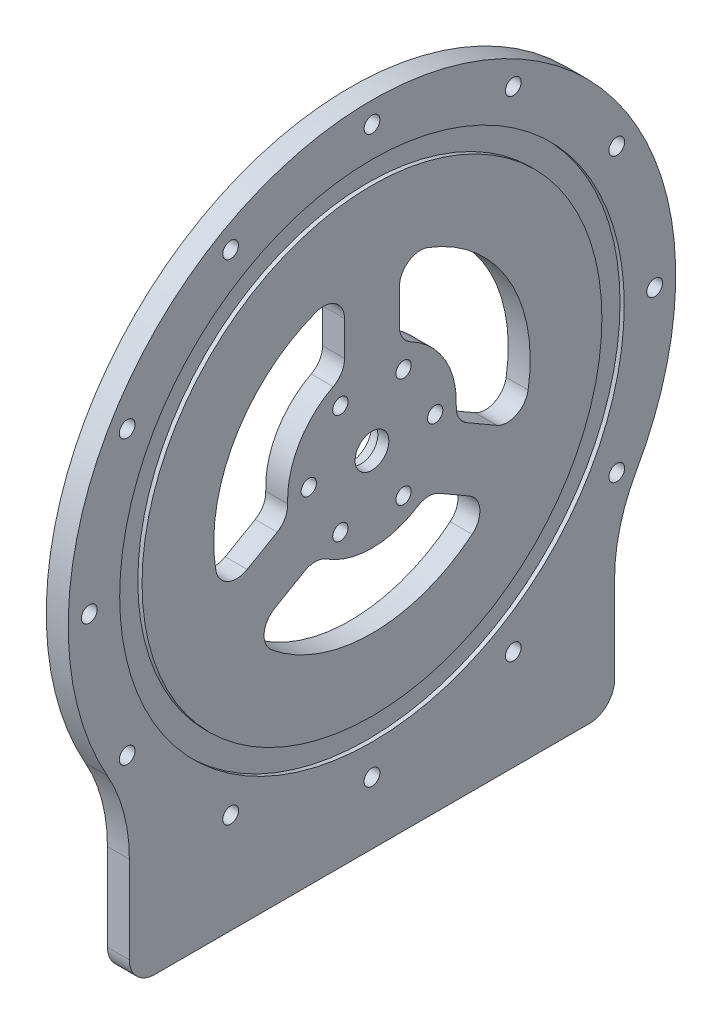
from build123d import *

# Parameters (mm, degrees)
SKETCH1_R              = 5.08
BOSS_EXTRUDE1_DEPTH    = 6.604
SKETCH2_R              = 6.477
CUT_EXTRUDE1_DEPTH     = 3.302
SKETCH3_R              = 75.946
SKETCH3_R_2            = 69.215
CUT_EXTRUDE2_DEPTH     = 1.27
SKETCH4_R              = 2.38125
CUT_EXTRUDE3_DEPTH     = 139.530727768
SKETCH5_R              = 3.77825
CUT_EXTRUDE4_DEPTH     = 1.27
F_12_28_TAPPED_HOLE1_D = 4.6228
CUT_EXTRUDE5_DEPTH     = 139.530727768


with BuildPart() as part:
    # Sketch1 → Boss-Extrude1 (new body)
    with BuildSketch(Plane(origin=(0, 0, 0), x_dir=(0, 0, -1), z_dir=(1, 0, 0))):
        with BuildLine():
            Line((-65.405, -103.855072673), (65.405, -103.855072673))
            ThreePointArc((65.405, -103.855072673), (70.793153673, -101.623226346), (73.025, -96.235072673))
            Line((73.025, -96.235072673), (73.025, -69.997049759))
            ThreePointArc((73.025, -69.997049759), (74.696702219, -57.072253546), (79.601785714, -44.998103417))
            ThreePointArc((79.601785714, -44.998103417), (0, 91.44), (-79.601785714, -44.998103417))
            ThreePointArc((-79.601785714, -44.998103417), (-74.696702219, -57.072253546), (-73.025, -69.997049759))
            Line((-73.025, -69.997049759), (-73.025, -96.235072673))
            ThreePointArc((-73.025, -96.235072673), (-70.793153673, -101.623226346), (-65.405, -103.855072673))
        make_face()
        Circle(SKETCH1_R, mode=Mode.SUBTRACT)
    extrude(amount=BOSS_EXTRUDE1_DEPTH)

    # Sketch2 → Cut-Extrude1 (cut)
    with BuildSketch(Plane(origin=(0, 0, 0), x_dir=(0, 0, -1), z_dir=(1, 0, 0))):
        Circle(SKETCH2_R)
    extrude(amount=CUT_EXTRUDE1_DEPTH, mode=Mode.SUBTRACT)

    # Sketch3 → Cut-Extrude2 (cut)
    with BuildSketch(Plane(origin=(6.604, 0, 0), x_dir=(0, 0, -1), z_dir=(1, 0, 0))):
        Circle(SKETCH3_R)
        Circle(SKETCH3_R_2, mode=Mode.SUBTRACT)
    extrude(amount=-CUT_EXTRUDE2_DEPTH, mode=Mode.SUBTRACT)

    # Sketch4 → Cut-Extrude3 (cut, through all)
    with BuildSketch(Plane.ZY):
        with Locations((0, 85.09)):
            Circle(SKETCH4_R)
        with Locations((42.545, 73.690101608)):
            Circle(SKETCH4_R)
        with Locations((73.690101608, 42.545)):
            Circle(SKETCH4_R)
        with Locations((85.09, 0)):
            Circle(SKETCH4_R)
        with Locations((73.690101608, -42.545)):
            Circle(SKETCH4_R)
        with Locations((42.545, -73.690101608)):
            Circle(SKETCH4_R)
        with Locations((0, -85.09)):
            Circle(SKETCH4_R)
        with Locations((-42.545, -73.690101608)):
            Circle(SKETCH4_R)
        with Locations((-73.690101608, -42.545)):
            Circle(SKETCH4_R)
        with Locations((-85.09, 0)):
            Circle(SKETCH4_R)
        with Locations((-73.690101608, 42.545)):
            Circle(SKETCH4_R)
        with Locations((-42.545, 73.690101608)):
            Circle(SKETCH4_R)
    extrude(amount=-CUT_EXTRUDE3_DEPTH, mode=Mode.SUBTRACT)

    # Sketch5 → Cut-Extrude4 (cut)
    with BuildSketch(Plane.ZY):
        with Locations((0, 85.09)):
            Circle(SKETCH5_R)
        with Locations((42.545, 73.690101608)):
            Circle(SKETCH5_R)
        with Locations((-42.545, 73.690101608)):
            Circle(SKETCH5_R)
        with Locations((73.690101608, 42.545)):
            Circle(SKETCH5_R)
        with Locations((85.09, 0)):
            Circle(SKETCH5_R)
        with Locations((73.690101608, -42.545)):
            Circle(SKETCH5_R)
        with Locations((42.545, -73.690101608)):
            Circle(SKETCH5_R)
        with Locations((0, -85.09)):
            Circle(SKETCH5_R)
        with Locations((-42.545, -73.690101608)):
            Circle(SKETCH5_R)
        with Locations((-73.690101608, -42.545)):
            Circle(SKETCH5_R)
        with Locations((-85.09, 0)):
            Circle(SKETCH5_R)
        with Locations((-73.690101608, 42.545)):
            Circle(SKETCH5_R)
    extrude(amount=-CUT_EXTRUDE4_DEPTH, mode=Mode.SUBTRACT)

    # #12-28 Tapped Hole1 (through all)
    with Locations(Plane(origin=(0, -19.744236158, 32.427308481), x_dir=(0, 0, 1), z_dir=(-1, 0, 0))):
        with Locations((-41.933180497, 36.208889459), (-22.921436466, 36.208889459), (-13.41556445, 19.744236158), (-22.921436466, 3.279582857), (-41.933180497, 3.279582857), (-51.439052512, 19.744236158)):
            Hole(F_12_28_TAPPED_HOLE1_D / 2)

    # Sketch9 → Cut-Extrude5 (cut, through all)
    with BuildSketch(Plane.ZY):
        with BuildLine():
            Line((-8.255, 38.60465775), (-8.255, 28.191425558))
            ThreePointArc((-8.255, 28.191425558), (-9.179557622, 24.89186877), (-11.684, 22.553140447))
            ThreePointArc((-11.684, 22.553140447), (-21.997045256, 12.7), (-25.373592562, -1.157929405))
            ThreePointArc((-25.373592562, -1.157929405), (-26.146769513, -4.496204289), (-28.541990702, -6.946673071))
            Line((-28.541990702, -6.946673071), (-37.560114316, -12.153289167))
            ThreePointArc((-37.560114316, -12.153289167), (-43.454984563, -12.392041955), (-47.00205498, -7.677724445))
            ThreePointArc((-47.00205498, -7.677724445), (-41.244459855, 23.8125), (-16.851923077, 44.543835865))
            ThreePointArc((-16.851923077, 44.543835865), (-10.995669144, 43.82914153), (-8.255, 38.60465775))
        make_face()
        with BuildLine():
            Line((8.255, 38.60465775), (8.255, 28.191425558))
            ThreePointArc((8.255, 28.191425558), (9.179557622, 24.89186877), (11.684, 22.553140447))
            ThreePointArc((11.684, 22.553140447), (21.997045256, 12.7), (25.373592562, -1.157929405))
            ThreePointArc((25.373592562, -1.157929405), (26.146769513, -4.496204289), (28.541990702, -6.946673071))
            Line((28.541990702, -6.946673071), (37.560114316, -12.153289167))
            ThreePointArc((37.560114316, -12.153289167), (43.454984563, -12.392041955), (47.00205498, -7.677724445))
            ThreePointArc((47.00205498, -7.677724445), (41.244459855, 23.8125), (16.851923077, 44.543835865))
            ThreePointArc((16.851923077, 44.543835865), (10.995669144, 43.82914153), (8.255, 38.60465775))
        make_face()
        with BuildLine():
            Line((29.305114316, -26.451368583), (20.286990702, -21.244752487))
            ThreePointArc((20.286990702, -21.244752487), (16.967211891, -20.395664481), (13.689592562, -21.395211041))
            ThreePointArc((13.689592562, -21.395211041), (0, -25.4), (-13.689592562, -21.395211041))
            ThreePointArc((-13.689592562, -21.395211041), (-16.967211891, -20.395664481), (-20.286990702, -21.244752487))
            Line((-20.286990702, -21.244752487), (-29.305114316, -26.451368583))
            ThreePointArc((-29.305114316, -26.451368583), (-32.459315419, -31.437099575), (-30.150131903, -36.86611142))
            ThreePointArc((-30.150131903, -36.86611142), (0, -47.625), (30.150131903, -36.86611142))
            ThreePointArc((30.150131903, -36.86611142), (32.459315419, -31.437099575), (29.305114316, -26.451368583))
        make_face()
    extrude(amount=-CUT_EXTRUDE5_DEPTH, mode=Mode.SUBTRACT)


solid = part.part
